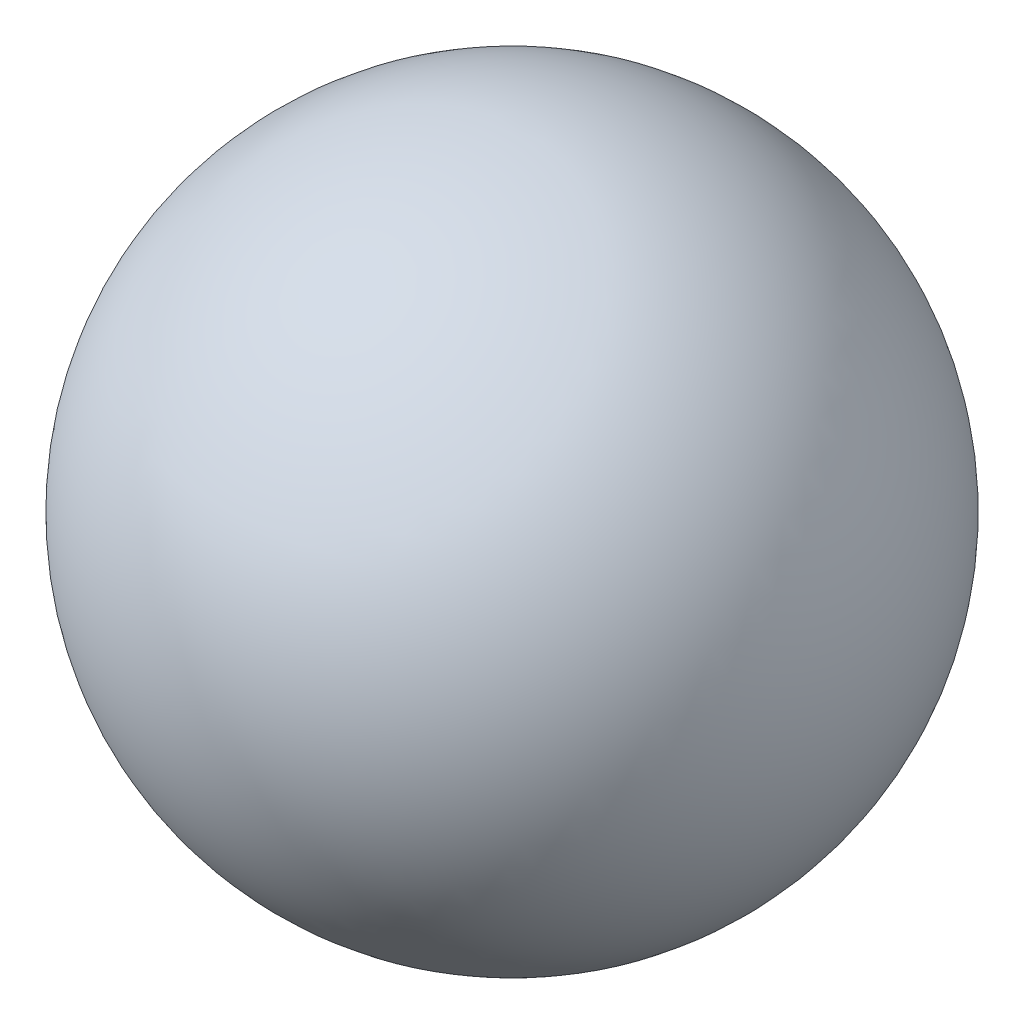
from build123d import *


with BuildPart() as part:
    # Sketch1 → Revolve3 (revolve)
    with BuildSketch(Plane.XY):
        with BuildLine():
            Line((0, 4.7625), (0, -4.7625))
            ThreePointArc((0, -4.7625), (-4.7625, 0), (0, 4.7625))
        make_face()
    revolve(axis=Axis((0, 4.7625, 0), (0, -1, 0)))


solid = part.part
